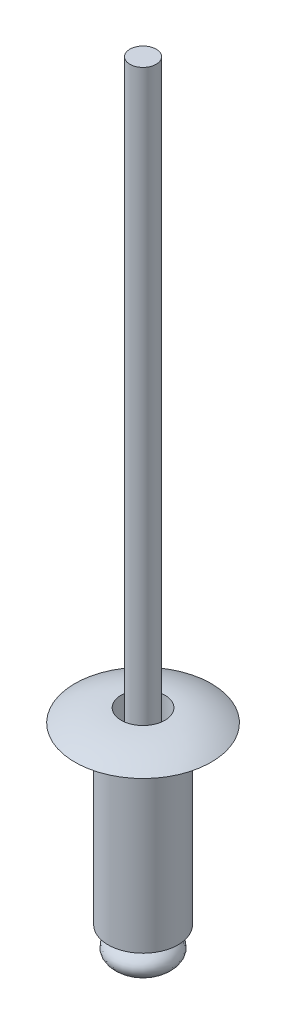
from build123d import *


with BuildPart() as part:
    # Szkic1 → Obrót1 (revolve)
    with BuildSketch(Plane.XY):
        with BuildLine():
            Line((-1.25, 10.75), (-1.25, 0))
            Line((-1.25, 0), (-2, 0))
            Line((-2, 0), (-2, 10))
            Line((-2, 10), (-3.9, 10))
            ThreePointArc((-3.9, 10), (-2.627043935, 10.558888572), (-1.25, 10.75))
        make_face()
        with BuildLine():
            Line((-1.24, 1), (-1.24, -0.5))
            add(Edge.make_bspline(
                [(-1.24, -0.5), (-4.212515907, -2), (0, -2)],
                knots=[5.499860619, 5.499860619, 5.499860619, 7.853981634, 7.853981634, 7.853981634], degree=2, weights=[1, 0.383641047, 1]))
            Line((0, -2), (0, 43))
            Line((0, 43), (-0.75, 43))
            Line((-0.75, 43), (-0.75, 1))
            Line((-0.75, 1), (-1.24, 1))
        make_face()
    revolve(axis=Axis((0, 0, 0), (0, 1, 0)))


solid = part.part
